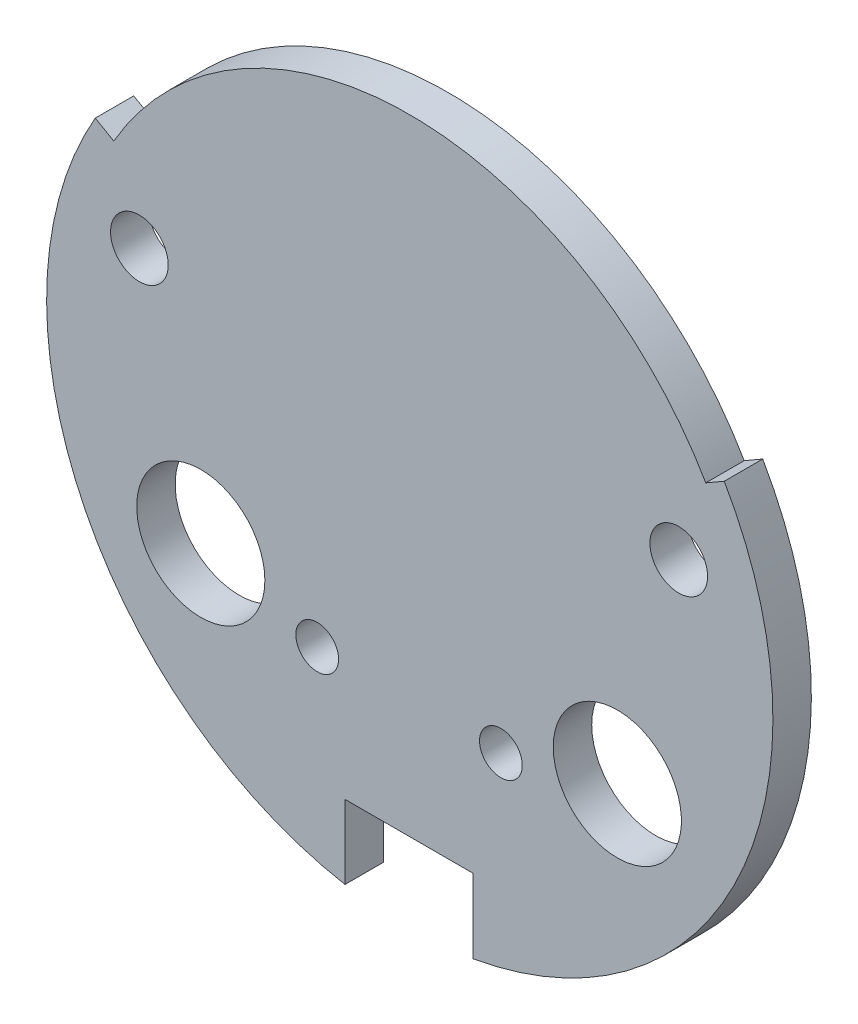
from build123d import *

# Parameters (mm, degrees)
BOSS_EXTRUDE1_DEPTH = 1.8
SKETCH2_R           = 3
SKETCH2_R_2         = 1.35
SKETCH2_R_3         = 1
CUT_EXTRUDE1_DEPTH  = 25.20291264


with BuildPart() as part:
    # Sketch1 → Boss-Extrude1 (new body)
    with BuildSketch(Plane.XY):
        with BuildLine():
            Line((-3.352285907, -12.464521672), (2.647714093, -12.464521672))
            Line((2.647714093, -12.464521672), (2.647714093, -15.928650375))
            ThreePointArc((2.647714093, -15.928650375), (15.091360711, -6.367255259), (14.403401907, 9.310478328))
            Line((14.403401907, 9.310478328), (13.537376503, 8.810478328))
            ThreePointArc((13.537376503, 8.810478328), (-0.319029957, 16.810478328), (-14.175436418, 8.810478328))
            Line((-14.175436418, 8.810478328), (-15.041461822, 9.310478328))
            ThreePointArc((-15.041461822, 9.310478328), (-15.743655386, -6.336614115), (-3.352285907, -15.916725812))
            Line((-3.352285907, -15.916725812), (-3.352285907, -12.464521672))
        make_face()
    extrude(amount=BOSS_EXTRUDE1_DEPTH)

    # Sketch2 → Cut-Extrude1 (cut, through all)
    with BuildSketch(Plane.XY.offset(1.8)):
        with Locations((-10.102285907, -5.464521672)):
            Circle(SKETCH2_R)
        with Locations((9.397714093, -5.464521672)):
            Circle(SKETCH2_R)
        with Locations((-12.977285907, 5.060478328)):
            Circle(SKETCH2_R_2)
        with Locations((12.272714093, 5.060478328)):
            Circle(SKETCH2_R_2)
        with Locations((-4.652285907, -6.939521672)):
            Circle(SKETCH2_R_3)
        with Locations((3.947714093, -6.939521672)):
            Circle(SKETCH2_R_3)
    extrude(amount=-CUT_EXTRUDE1_DEPTH, mode=Mode.SUBTRACT)


solid = part.part
